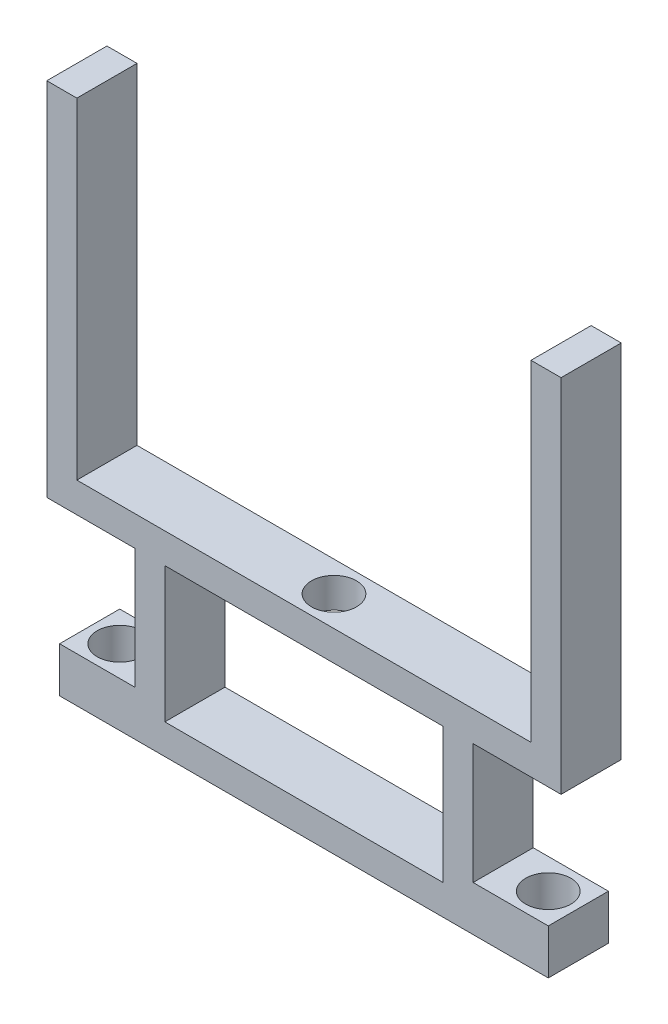
from build123d import *

# Parameters (mm, degrees)
SKETCH1_R           = 1.5
BOSS_EXTRUDE1_DEPTH = 3
SKETCH2_W           = 22.5
SKETCH2_H           = 4
BOSS_EXTRUDE2_DEPTH = 10
SKETCH3_W           = 18.5
SKETCH3_H           = 9
CUT_EXTRUDE1_DEPTH  = 10
SKETCH4_W           = 30.2
SKETCH4_H           = 4
BOSS_EXTRUDE3_DEPTH = 2
SKETCH5_R           = 1.5
CUT_EXTRUDE2_DEPTH  = 2
SKETCH6_W           = 4
SKETCH6_H           = 2
BOSS_EXTRUDE4_DEPTH = 2
SKETCH7_W           = 2
SKETCH7_H           = 4
BOSS_EXTRUDE5_DEPTH = 22
SKETCH8_W           = 4
SKETCH8_H           = 2
BOSS_EXTRUDE6_DEPTH = 2
SKETCH9_W           = 2
SKETCH9_H           = 4
BOSS_EXTRUDE7_DEPTH = 22


with BuildPart() as part:
    # Sketch1 → Boss-Extrude1 (new body)
    with BuildSketch(Plane(origin=(0, 0, 0), x_dir=(1, 0, 0), z_dir=(0, 1, 0))):
        Polygon((30.5, 2), (0, 2), (-2, 2), (-2, -2), (30.5, -2), align=None)
        Circle(SKETCH1_R, mode=Mode.SUBTRACT)
        with BuildLine():
            ThreePointArc((30, 0), (28.5, -1.5), (27, 0))
            ThreePointArc((27, 0), (28.5, 1.5), (30, 0))
        make_face(mode=Mode.SUBTRACT)
    extrude(amount=BOSS_EXTRUDE1_DEPTH)

    # Sketch2 → Boss-Extrude2 (add)
    with BuildSketch(Plane(origin=(0, 3, 0), x_dir=(1, 0, 0), z_dir=(0, 1, 0))):
        with Locations((14.25, 0)):
            Rectangle(SKETCH2_W, SKETCH2_H)
    extrude(amount=BOSS_EXTRUDE2_DEPTH)

    # Sketch3 → Cut-Extrude1 (cut)
    with BuildSketch(Plane.XY.offset(2)):
        with Locations((14.25, 6.5)):
            Rectangle(SKETCH3_W, SKETCH3_H)
    extrude(amount=-CUT_EXTRUDE1_DEPTH, mode=Mode.SUBTRACT)

    # Sketch4 → Boss-Extrude3 (add)
    with BuildSketch(Plane(origin=(0, 13, 0), x_dir=(1, 0, 0), z_dir=(0, 1, 0))):
        with Locations((14.25, 0)):
            Rectangle(SKETCH4_W, SKETCH4_H)
    extrude(amount=-BOSS_EXTRUDE3_DEPTH)

    # Sketch5 → Cut-Extrude2 (cut)
    with BuildSketch(Plane(origin=(0, 13, 0), x_dir=(1, 0, 0), z_dir=(0, 1, 0))):
        with Locations((14.25, 0)):
            Circle(SKETCH5_R)
    extrude(amount=-CUT_EXTRUDE2_DEPTH, mode=Mode.SUBTRACT)

    # Sketch6 → Boss-Extrude4 (add)
    with BuildSketch(Plane.ZY.offset(0.85)):
        with Locations((0, 12)):
            Rectangle(SKETCH6_W, SKETCH6_H)
    extrude(amount=BOSS_EXTRUDE4_DEPTH)

    # Sketch7 → Boss-Extrude5 (add)
    with BuildSketch(Plane(origin=(0, 13, 0), x_dir=(1, 0, 0), z_dir=(0, 1, 0))):
        with Locations((-1.85, 0)):
            Rectangle(SKETCH7_W, SKETCH7_H)
    extrude(amount=BOSS_EXTRUDE5_DEPTH)

    # Sketch8 → Boss-Extrude6 (add)
    with BuildSketch(Plane(origin=(29.35, 0, 0), x_dir=(0, 0, -1), z_dir=(1, 0, 0))):
        with Locations((0, 12)):
            Rectangle(SKETCH8_W, SKETCH8_H)
    extrude(amount=BOSS_EXTRUDE6_DEPTH)

    # Sketch9 → Boss-Extrude7 (add)
    with BuildSketch(Plane(origin=(0, 13, 0), x_dir=(1, 0, 0), z_dir=(0, 1, 0))):
        with Locations((30.35, 0)):
            Rectangle(SKETCH9_W, SKETCH9_H)
    extrude(amount=BOSS_EXTRUDE7_DEPTH)


solid = part.part
